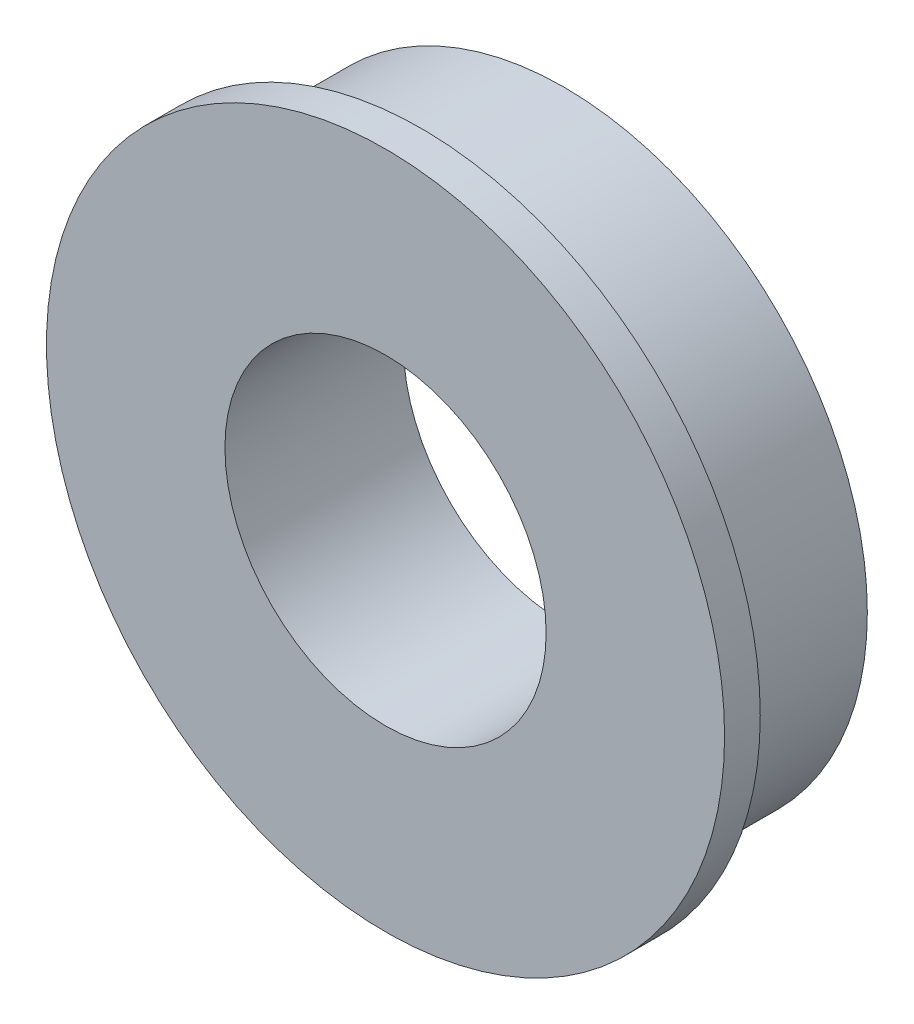
from build123d import *

# Parameters (mm, degrees)
SKETCH1_R           = 8.5
SKETCH1_R_2         = 4.5
BOSS_EXTRUDE1_DEPTH = 4
SKETCH2_R           = 9.5
SKETCH2_R_2         = 4.5
BOSS_EXTRUDE2_DEPTH = 1


with BuildPart() as part:
    # Sketch1 → Boss-Extrude1 (new body)
    with BuildSketch(Plane.XY):
        Circle(SKETCH1_R)
        Circle(SKETCH1_R_2, mode=Mode.SUBTRACT)
    extrude(amount=BOSS_EXTRUDE1_DEPTH)

    # Sketch2 → Boss-Extrude2 (add)
    with BuildSketch(Plane.XY.offset(4)):
        Circle(SKETCH2_R)
        Circle(SKETCH2_R_2, mode=Mode.SUBTRACT)
    extrude(amount=BOSS_EXTRUDE2_DEPTH)


solid = part.part
